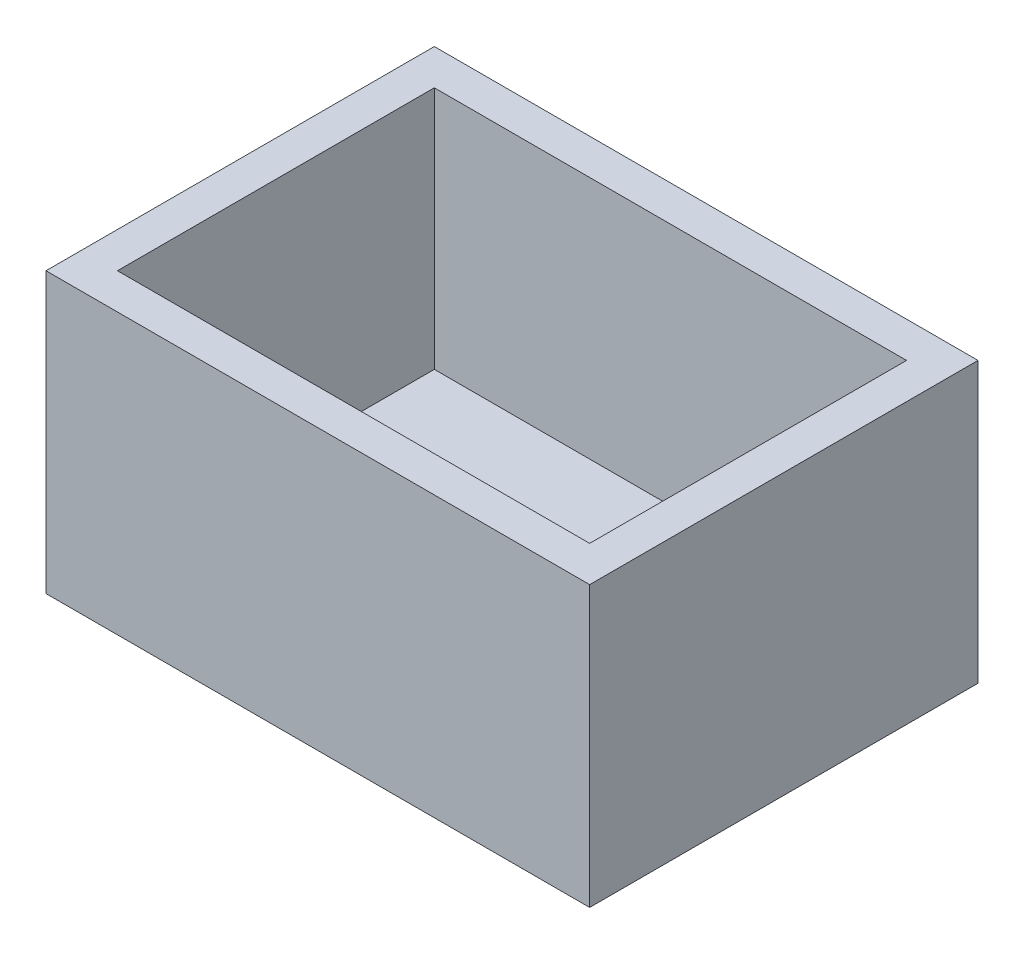
from build123d import *

# Parameters (mm, degrees)
SKETCH1_W           = 35
SKETCH1_H           = 25
BOSS_EXTRUDE1_DEPTH = 18
SHELL1_T            = -2.3


with BuildPart() as part:
    # Sketch1 → Boss-Extrude1 (new body)
    with BuildSketch(Plane(origin=(0, 0, 0), x_dir=(1, 0, 0), z_dir=(0, 1, 0))):
        with Locations((17.5, 12.5)):
            Rectangle(SKETCH1_W, SKETCH1_H)
    extrude(amount=BOSS_EXTRUDE1_DEPTH)

    # Shell1
    shell1_openings = [part.faces().sort_by_distance(p)[0] for p in [
        (17.5, 18, -12.5),
    ]]
    offset(amount=SHELL1_T, openings=shell1_openings, kind=Kind.INTERSECTION)


solid = part.part
